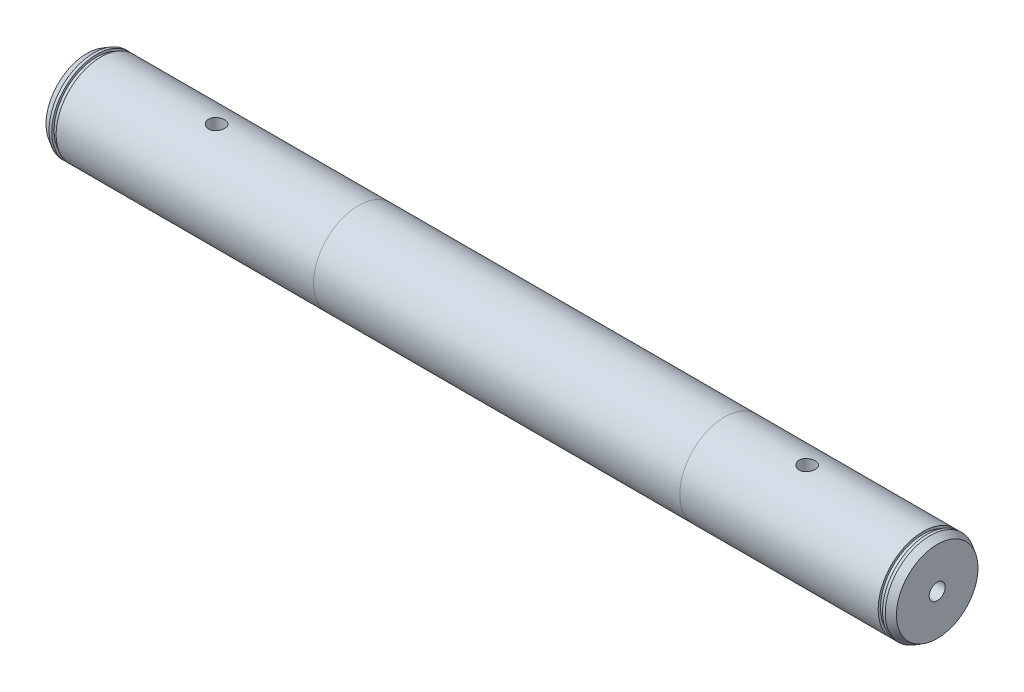
from build123d import *
from OCP.BRepFilletAPI import BRepFilletAPI_MakeChamfer

# Parameters (mm, degrees)
M8_GEWINDEBOHRUNG1_D          = 6.8
M8_GEWINDEBOHRUNG1_DEPTH      = 325
M8_GEWINDEBOHRUNG1_TIP        = 2.042926105
SKIZZE18_W                    = 3.4
SKIZZE18_H                    = 27
M8_GEWINDEBOHRUNG3_AT_2_COUNT = 2
M8_GEWINDEBOHRUNG3_AT_2_PITCH = 250
SPIEGELN2_COPY_1_SKETCH_W     = 3.4
SPIEGELN2_COPY_1_SKETCH_H     = 27
SKIZZE19_W                    = 1.85
SKIZZE19_H                    = 1
SKIZZE20_W                    = 1.85
SKIZZE20_H                    = 1
SKETCH1_W                     = 21.407583332
SKETCH1_H                     = 15.084330907
CHAMFER_1_SIZE                = 3
CHAMFER_1_SIZE2               = 1.732050808


with BuildPart() as part:
    # Skizze1 → Rotation1 (revolve)
    with BuildSketch(Plane.XY):
        Polygon((180, 19), (180, 0), (-180, 0), (-180, 19), (-65, 19), (-65, 27), (-60, 27), (-60, 19.0001), (90, 19.0001), align=None)
    revolve(axis=Axis((180, 0, 0), (-1, 0, 0)))

    # M8 Gewindebohrung1
    with Locations(Plane(origin=(180, 0, 0), x_dir=(0, 0, -1), z_dir=(1, 0, 0))):
        with Locations((0, 0)):
            Hole(M8_GEWINDEBOHRUNG1_D / 2, depth=M8_GEWINDEBOHRUNG1_DEPTH)
            with Locations((0, 0, -(M8_GEWINDEBOHRUNG1_DEPTH + M8_GEWINDEBOHRUNG1_TIP / 2))):  # 118° drill point
                Cone(0, M8_GEWINDEBOHRUNG1_D / 2, M8_GEWINDEBOHRUNG1_TIP, mode=Mode.SUBTRACT)

    # Skizze18 → M8 Gewindebohrung3 (revolve, cut)
    with BuildSketch(Plane(origin=(-125, 0, 0), x_dir=(0, 0, -1), z_dir=(1, 0, 0))):
        with Locations((1.7, 13.5)):
            Rectangle(SKIZZE18_W, SKIZZE18_H)
    m8_gewindebohrung3 = revolve(axis=Axis((-125, -6.35, 0), (0, 1, 0)), mode=Mode.SUBTRACT)

    # M8 Gewindebohrung3 at 2: M8 Gewindebohrung3 ×2
    with Locations(*[(i * M8_GEWINDEBOHRUNG3_AT_2_PITCH, 0, 0) for i in range(1, M8_GEWINDEBOHRUNG3_AT_2_COUNT)]):
        add(m8_gewindebohrung3, mode=Mode.SUBTRACT)

    # Spiegeln2: M8 Gewindebohrung3 across plane
    add(m8_gewindebohrung3.mirror(Plane.ZX), mode=Mode.SUBTRACT)

    # Spiegeln2 copy 1 sketch → Spiegeln2 copy 1 (revolve, cut)
    with BuildSketch(Plane(origin=(125, 0, 0), x_dir=(0, 0, -1), z_dir=(1, 0, 0))):
        with Locations((1.7, -13.5)):
            Rectangle(SPIEGELN2_COPY_1_SKETCH_W, SPIEGELN2_COPY_1_SKETCH_H)
    revolve(axis=Axis((125, 6.35, 0), (0, 1, 0)), mode=Mode.SUBTRACT)

    # Skizze19 → Schnitt-Rotation1 (revolve, cut)
    with BuildSketch(Plane.XY):
        with Locations((174.925, 18.5)):
            Rectangle(SKIZZE19_W, SKIZZE19_H)
    revolve(axis=Axis((-88.99, 0, 0), (1, 0, 0)), mode=Mode.SUBTRACT)

    # Skizze20 → Schnitt-Rotation2 (revolve, cut)
    with BuildSketch(Plane.XY):
        with Locations((-174.925, 18.5)):
            Rectangle(SKIZZE20_W, SKIZZE20_H)
    revolve(axis=Axis((-88.99, 0, 0), (1, 0, 0)), mode=Mode.SUBTRACT)

    # Sketch1 → Cut-Revolve1 (revolve, cut)
    with BuildSketch(Plane.XY):
        with Locations((-62.803513507, 26.542265454)):
            Rectangle(SKETCH1_W, SKETCH1_H)
    revolve(axis=Axis((-202.232213843, 0, 0), (1, 0, 0)), mode=Mode.SUBTRACT)

    # 倒角1: one chamfer whose edges measure the first distance from different faces: ONE call of the kernel's chamfer builder (chamfer() names one face for all edges)
    chamfer_1_edges_1 = [part.edges().sort_by_distance(p)[0] for p in [
        (-180, -19, 0),
    ]]
    chamfer_1_side_1 = [part.faces().sort_by_distance(p)[0] for p in [
        (-177.925, -19, 0),
    ]]
    chamfer_1_edges_2 = [part.edges().sort_by_distance(p)[0] for p in [
        (180, -19, 0),
    ]]
    chamfer_1_side_2 = [part.faces().sort_by_distance(p)[0] for p in [
        (177.925, -19.0001, 0),
    ]]
    chamfer_1 = BRepFilletAPI_MakeChamfer(part.part.solid().wrapped)
    for e in chamfer_1_edges_1:
        chamfer_1.Add(CHAMFER_1_SIZE, CHAMFER_1_SIZE2, e.wrapped, chamfer_1_side_1[0].wrapped)  # the first distance lies on this face
    for e in chamfer_1_edges_2:
        chamfer_1.Add(CHAMFER_1_SIZE, CHAMFER_1_SIZE2, e.wrapped, chamfer_1_side_2[0].wrapped)  # the first distance lies on this face
    add(Compound.cast(chamfer_1.Shape()), mode=Mode.REPLACE)


solid = part.part
